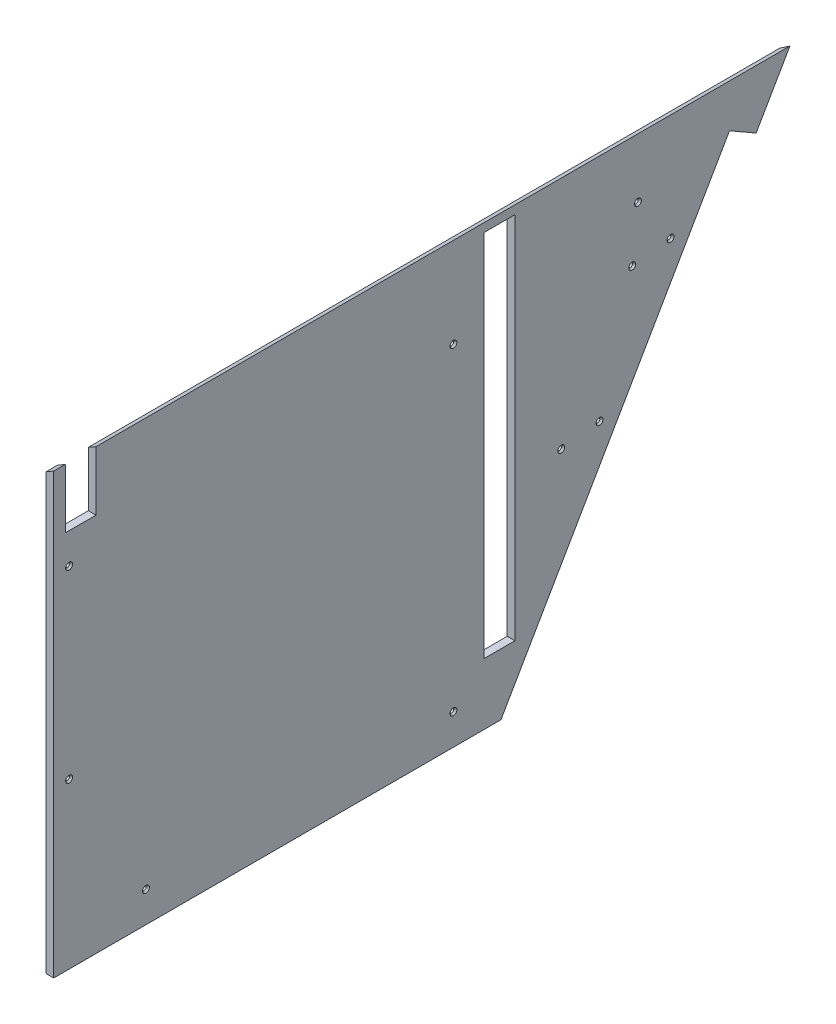
from build123d import *

# Parameters (mm, degrees)
BOSS_EXTRUDE1_DEPTH                            = 6.35
SKETCH2_W                                      = 25.4
SKETCH2_H                                      = 304.8
CUT_EXTRUDE1_DEPTH                             = 589.439392722
CUT_EXTRUDE2_DEPTH                             = 589.439392722
CSK_FOR_4_FLAT_HEAD_MACHINE_SCREW3_D           = 3.2639
CSK_FOR_4_FLAT_HEAD_MACHINE_SCREW3_CSINK_D     = 5.715
CSK_FOR_4_FLAT_HEAD_MACHINE_SCREW3_CSINK_ANGLE = 82
CSK_FOR_4_FLAT_HEAD_MACHINE_SCREW2_D           = 3.2639
CSK_FOR_4_FLAT_HEAD_MACHINE_SCREW2_CSINK_D     = 5.715
CSK_FOR_4_FLAT_HEAD_MACHINE_SCREW2_CSINK_ANGLE = 82
CSK_FOR_4_FLAT_HEAD_MACHINE_SCREW1_D           = 3.2639
CSK_FOR_4_FLAT_HEAD_MACHINE_SCREW1_CSINK_D     = 5.715
CSK_FOR_4_FLAT_HEAD_MACHINE_SCREW1_CSINK_ANGLE = 82
CSK_FOR_4_FLAT_HEAD_MACHINE_SCREW4_D           = 3.2639
CSK_FOR_4_FLAT_HEAD_MACHINE_SCREW4_CSINK_D     = 5.715
CSK_FOR_4_FLAT_HEAD_MACHINE_SCREW4_CSINK_ANGLE = 82
CHAMFER1_SIZE                                  = 10.558581723
CHAMFER1_SIZE_2                                = 6.096
CUT_EXTRUDE3_REACH                             = 587.916
SKETCH7_W                                      = 25.4
SKETCH7_H                                      = 49.005174209


with BuildPart() as part:
    # Sketch1 → Boss-Extrude1 (new body)
    with BuildSketch(Plane(origin=(0, 0, 0), x_dir=(0, 0, -1), z_dir=(1, 0, 0))):
        Polygon((487.035764647, 330.176862244), (276.230747609, -34.948137756), (-122.564235353, -34.948137756), (-122.564235353, 330.176862244), align=None)
    extrude(amount=BOSS_EXTRUDE1_DEPTH)

    # Sketch2 → Cut-Extrude1 (cut, through all)
    with BuildSketch(Plane(origin=(6.35, 0, 0), x_dir=(0, 0, -1), z_dir=(1, 0, 0))):
        with Locations((245.735764647, 168.251862244)):
            Rectangle(SKETCH2_W, SKETCH2_H)
    extrude(amount=-CUT_EXTRUDE1_DEPTH, mode=Mode.SUBTRACT)

    # Sketch3 → Cut-Extrude2 (cut, through all)
    with BuildSketch(Plane(origin=(6.35, 0, 0), x_dir=(0, 0, -1), z_dir=(1, 0, 0))):
        Polygon((457.706370973, 279.376862244), (276.230747609, -34.948137756), (246.901353935, -34.948137756), (435.709325716, 292.076862244), align=None)
    extrude(amount=-CUT_EXTRUDE2_DEPTH, mode=Mode.SUBTRACT)

    # CSK for #4 Flat Head Machine Screw3 (through all)
    with Locations(Plane(origin=(6.35, 253.341862244, 109.864235353), x_dir=(0, 0, 1), z_dir=(1, 0, 0))):
        with Locations((0, 0), (-317.5, 0), (-469.9, -25.4)):
            CounterSinkHole(CSK_FOR_4_FLAT_HEAD_MACHINE_SCREW3_D / 2, CSK_FOR_4_FLAT_HEAD_MACHINE_SCREW3_CSINK_D / 2, counter_sink_angle=CSK_FOR_4_FLAT_HEAD_MACHINE_SCREW3_CSINK_ANGLE)

    # CSK for #4 Flat Head Machine Screw2 (through all)
    with Locations(Plane(origin=(6.35, 100.941862244, 109.864235353), x_dir=(0, 0, 1), z_dir=(1, 0, 0))):
        with Locations((0, 0)):
            CounterSinkHole(CSK_FOR_4_FLAT_HEAD_MACHINE_SCREW2_D / 2, CSK_FOR_4_FLAT_HEAD_MACHINE_SCREW2_CSINK_D / 2, counter_sink_angle=CSK_FOR_4_FLAT_HEAD_MACHINE_SCREW2_CSINK_ANGLE)

    # CSK for #4 Flat Head Machine Screw1 (through all)
    with Locations(Plane(origin=(6.35, -9.548137756, 46.364235353), x_dir=(0, 0, 1), z_dir=(1, 0, 0))):
        with Locations((0, 0), (-254, 0)):
            CounterSinkHole(CSK_FOR_4_FLAT_HEAD_MACHINE_SCREW1_D / 2, CSK_FOR_4_FLAT_HEAD_MACHINE_SCREW1_CSINK_D / 2, counter_sink_angle=CSK_FOR_4_FLAT_HEAD_MACHINE_SCREW1_CSINK_ANGLE)

    # CSK for #4 Flat Head Machine Screw4 (through all)
    with Locations(Plane(origin=(6.35, 235.418036453, -355.337072673), x_dir=(0, 0, 1), z_dir=(1, 0, 0))):
        with Locations((0, 0), (-31.648510504, -4.016828178), (58.65878735, 101.6), (27.010276846, 97.583171822)):
            CounterSinkHole(CSK_FOR_4_FLAT_HEAD_MACHINE_SCREW4_D / 2, CSK_FOR_4_FLAT_HEAD_MACHINE_SCREW4_CSINK_D / 2, counter_sink_angle=CSK_FOR_4_FLAT_HEAD_MACHINE_SCREW4_CSINK_ANGLE)

    # Chamfer1
    # the kernel refuses this chamfer: 10.558581723, 6.096 mm, written as the material it takes off along each edge
    with BuildSketch(Plane(origin=(0, 330.176862244, 149.880191717), x_dir=(0.9998132206222078, 0.01932676561270281, 0), z_dir=(0, 0, -1))) as chamfer1_piece_1:
        Polygon((CHAMFER1_SIZE * 0.999813220617, CHAMFER1_SIZE * 0.0193267656126), (-CHAMFER1_SIZE_2 * 0.0193267656127, CHAMFER1_SIZE_2 * 0.999813220622), (0, 0), align=None)
    extrude(amount=664.231912729, mode=Mode.SUBTRACT)

    # Sketch7 → Cut-Extrude3 (cut, up to next)
    with BuildSketch(Plane(origin=(6.35, 0, 0), x_dir=(0, 0, -1), z_dir=(1, 0, 0)), mode=Mode.PRIVATE) as cut_extrude3_sk1:
        with Locations((-100.339235353, 303.244449348)):
            Rectangle(SKETCH7_W, SKETCH7_H)
    cut_extrude3_tool1 = extrude(cut_extrude3_sk1.sketch, amount=-CUT_EXTRUDE3_REACH, mode=Mode.PRIVATE) & part.part
    add(cut_extrude3_tool1.solids().sort_by_distance((6.35, 303.244449, 100.339235))[0], mode=Mode.SUBTRACT)


solid = part.part
